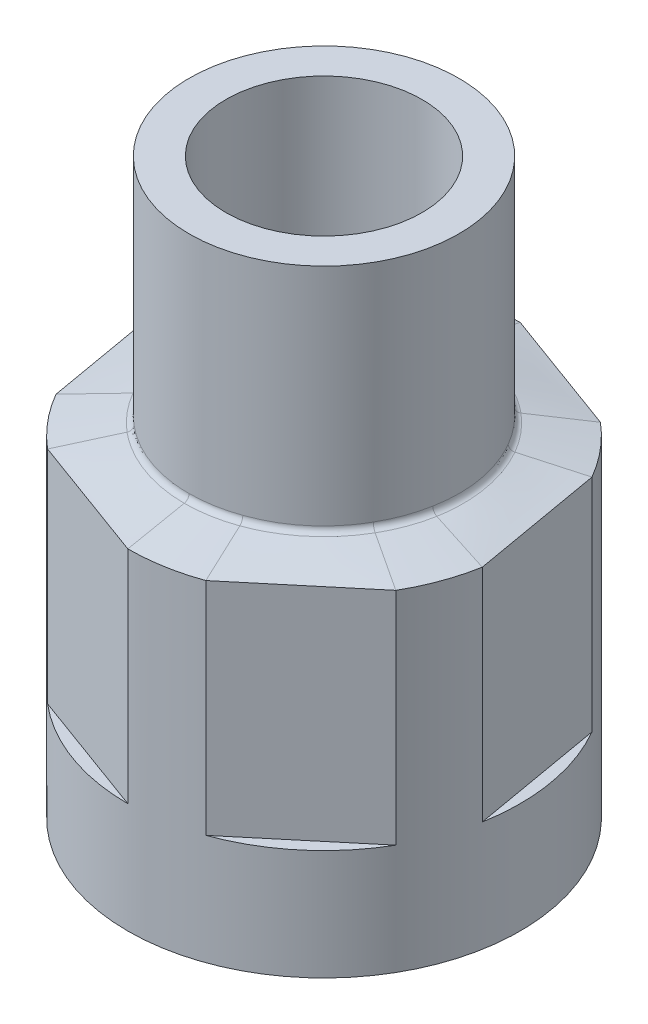
from build123d import *

# Parameters (mm, degrees)
SKETCH_2_R          = 11
SKETCH_1_R          = 11
SKETCH_3_R          = 8
CUT_EXTRUDE_1_DEPTH = 12
SKETCH_4_R          = 6.5
CUT_EXTRUDE_2_DEPTH = 20.646882877
SKETCH_2_3_R        = 11
SKETCH_8_R          = 16
EXTRUDE_1_DEPTH     = 9
SKETCH_10_R         = 13.9
EXTRUDE_2_DEPTH     = 1
SKETCH_11_R         = 10
CUT_EXTRUDE_3_DEPTH = 20
SKETCH_12_R         = 7
CUT_EXTRUDE_4_DEPTH = 9
FILLET_1_R          = 0.5


with BuildPart() as part:
    # Эскиз2 → По сечениям1 section 0
    with BuildSketch(Plane(origin=(0, -18.75, 0), x_dir=(1, 0, 0), z_dir=(0, 1, 0))):
        Circle(SKETCH_2_R)
    # Эскиз1 → По сечениям1 section 1
    with BuildSketch(Plane(origin=(0, 0, 0), x_dir=(1, 0, 0), z_dir=(0, 1, 0))):
        Circle(SKETCH_1_R)
    loft()

    # Эскиз3 → Вырез-Вытянуть1 (cut)
    with BuildSketch(Plane(origin=(0, 0, 0), x_dir=(1, 0, 0), z_dir=(0, 1, 0))):
        with Locations(Location((0, 0, 0), (0, 0, 270))):
            Circle(SKETCH_3_R)
    extrude(amount=-CUT_EXTRUDE_1_DEPTH, mode=Mode.SUBTRACT)

    # Эскиз4 → Вырез-Вытянуть2 (cut, through all)
    with BuildSketch(Plane(origin=(0, -12, 0), x_dir=(1, 0, 0), z_dir=(0, 1, 0))):
        with Locations(Location((0, 0, 0), (0, 0, 270))):
            Circle(SKETCH_4_R)
    extrude(amount=-CUT_EXTRUDE_2_DEPTH, mode=Mode.SUBTRACT)

    # Эскиз6 → По сечениям2 section 0
    with BuildSketch(Plane(origin=(0, -19.75, 0), x_dir=(1, 0, 0), z_dir=(0, 1, 0))):
        with BuildLine():
            Line((-5.416911302, 15.055134405), (-13.856406461, 8))
            ThreePointArc((-13.856406461, 8), (-15.024979201, 5.5), (-15.746584503, 2.836384405))
            Line((-15.746584503, 2.836384405), (-13.856406461, -8))
            ThreePointArc((-13.856406461, -8), (-12.275629321, -10.26201368), (-10.329673201, -12.21875))
            Line((-10.329673201, -12.21875), (0, -16))
            ThreePointArc((0, -16), (2.74934988, -15.76201368), (5.416911302, -15.055134405))
            Line((5.416911302, -15.055134405), (13.856406461, -8))
            ThreePointArc((13.856406461, -8), (15.024979201, -5.5), (15.746584503, -2.836384405))
            Line((15.746584503, -2.836384405), (13.856406461, 8))
            ThreePointArc((13.856406461, 8), (12.275629321, 10.26201368), (10.329673201, 12.21875))
            Line((10.329673201, 12.21875), (0, 16))
            ThreePointArc((0, 16), (-2.74934988, 15.76201368), (-5.416911302, 15.055134405))
        make_face()
    # Эскиз2<3> → По сечениям2 section 1
    with BuildSketch(Plane(origin=(0, -18.75, 0), x_dir=(1, 0, 0), z_dir=(0, 1, 0))):
        Circle(SKETCH_2_3_R)
    loft()

    # Эскиз7 for По сечениям3 → По сечениям3 section 0
    with BuildSketch(Plane(origin=(0, -37.75, 0), x_dir=(1, 0, 0), z_dir=(0, 1, 0))):
        with BuildLine():
            Line((-10.329673201, -12.21875), (0, -16))
            # circular arc as an exact rational Bezier (weights 1, cos(half-angle), 1)
            Bezier((0, -16), (2.790861559, -16), (5.416911302, -15.055134405), weights=[1, 0.985125855, 1])
            Line((5.416911302, -15.055134405), (13.856406461, -8))
            Bezier((13.856406461, -8), (15.25183724, -5.583042991), (15.746584503, -2.836384405), weights=[1, 0.985125855, 1])
            Line((15.746584503, -2.836384405), (13.856406461, 8))
            Bezier((13.856406461, 8), (12.460975681, 10.416957009), (10.329673201, 12.21875), weights=[1, 0.985125855, 1])
            Line((10.329673201, 12.21875), (0, 16))
            Bezier((0, 16), (-2.790861559, 16), (-5.416911302, 15.055134405), weights=[1, 0.985125855, 1])
            Line((-5.416911302, 15.055134405), (-13.856406461, 8))
            Bezier((-13.856406461, 8), (-15.25183724, 5.583042991), (-15.746584503, 2.836384405), weights=[1, 0.985125855, 1])
            Line((-15.746584503, 2.836384405), (-13.856406461, -8))
            Bezier((-13.856406461, -8), (-12.460975681, -10.416957009), (-10.329673201, -12.21875), weights=[1, 0.985125855, 1])
        make_face()
    # Эскиз6<3> for По сечениям3 → По сечениям3 section 1
    with BuildSketch(Plane(origin=(0, -19.75, 0), x_dir=(1, 0, 0), z_dir=(0, 1, 0))):
        with BuildLine():
            Line((-5.416911302, 15.055134405), (-13.856406461, 8))
            Bezier((-13.856406461, 8), (-15.25183724, 5.583042991), (-15.746584503, 2.836384405), weights=[1, 0.985125855, 1])
            Line((-15.746584503, 2.836384405), (-13.856406461, -8))
            Bezier((-13.856406461, -8), (-12.460975681, -10.416957009), (-10.329673201, -12.21875), weights=[1, 0.985125855, 1])
            Line((-10.329673201, -12.21875), (0, -16))
            Bezier((0, -16), (2.790861559, -16), (5.416911302, -15.055134405), weights=[1, 0.985125855, 1])
            Line((5.416911302, -15.055134405), (13.856406461, -8))
            Bezier((13.856406461, -8), (15.25183724, -5.583042991), (15.746584503, -2.836384405), weights=[1, 0.985125855, 1])
            Line((15.746584503, -2.836384405), (13.856406461, 8))
            Bezier((13.856406461, 8), (12.460975681, 10.416957009), (10.329673201, 12.21875), weights=[1, 0.985125855, 1])
            Line((10.329673201, 12.21875), (0, 16))
            Bezier((0, 16), (-2.790861559, 16), (-5.416911302, 15.055134405), weights=[1, 0.985125855, 1])
        make_face()
    loft()

    # Эскиз8 → Бобышка-Вытянуть1 (add)
    with BuildSketch(Plane(origin=(0, -37.75, 0), x_dir=(1, 0, 0), z_dir=(0, 1, 0))):
        with Locations(Location((0, 0, 0), (0, 0, 270))):
            Circle(SKETCH_8_R)
    extrude(amount=-EXTRUDE_1_DEPTH)

    # Эскиз10 → Бобышка-Вытянуть2 (add)
    with BuildSketch(Plane(origin=(0, -47.75, 0), x_dir=(1, 0, 0), z_dir=(0, 1, 0))):
        with Locations(Location((0, 0, 0), (0, 0, 270))):
            Circle(SKETCH_10_R)
    extrude(amount=EXTRUDE_2_DEPTH)

    # Эскиз11 → Вырез-Вытянуть3 (cut)
    with BuildSketch(Plane.XZ.offset(47.75)):
        with Locations(Location((0, 0, 0), (0, 0, 270))):
            Circle(SKETCH_11_R)
    extrude(amount=-CUT_EXTRUDE_3_DEPTH, mode=Mode.SUBTRACT)

    # Эскиз12 → Вырез-Вытянуть4 (cut)
    with BuildSketch(Plane.XZ.offset(27.75)):
        with Locations(Location((0, 0, 0), (0, 0, 270))):
            Circle(SKETCH_12_R)
    extrude(amount=-CUT_EXTRUDE_4_DEPTH, mode=Mode.SUBTRACT)

    # Скругление1
    fillet_1_edges = [part.edges().sort_by_distance(p)[0] for p in [
        (-3.78125, -18.75, 10.329673201),
        (-8.439495159, -18.75, 7.055134405),
        (-10.836384405, -18.75, 1.890178042),
        (-10.329673201, -18.75, -3.78125),
        (-7.055134405, -18.75, -8.439495159),
        (-1.890178042, -18.75, -10.836384405),
        (3.78125, -18.75, -10.329673201),
        (8.439495159, -18.75, -7.055134405),
        (10.625184089, -18.75, -2.847009496),
        (10.329673201, -18.75, 3.78125),
        (7.055134405, -18.75, 8.439495159),
        (1.890178042, -18.75, 10.836384405),
    ]]
    fillet(fillet_1_edges, radius=FILLET_1_R)


solid = part.part
